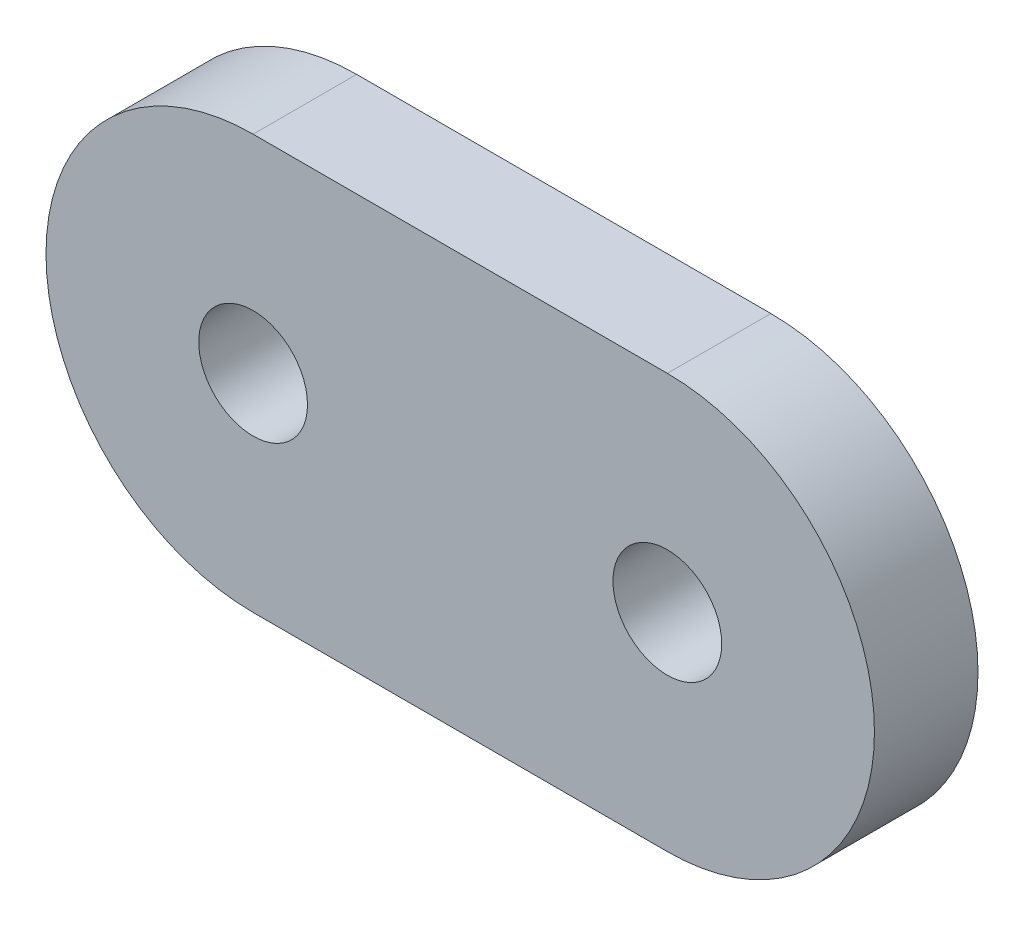
from build123d import *

# Parameters (mm, degrees)
BRIDA_BASE1_DEPTH         = 4
TALADRO_ROSCADO_M51_D     = 4.2
TALADRO_ROSCADO_M51_DEPTH = 14
TALADRO_ROSCADO_M51_TIP   = 1.2618073


# Sheet-metal steps are written as plain solids
with BuildPart() as part:
    # Croquis1 → Brida base1 (new body)
    with BuildSketch(Plane.XY):
        with BuildLine():
            Line((-19.990811444, 8), (-3.990811444, 8))
            ThreePointArc((-3.990811444, 8), (4.009188556, 0), (-3.990811444, -8))
            Line((-3.990811444, -8), (-19.990811444, -8))
            ThreePointArc((-19.990811444, -8), (-27.990811444, 0), (-19.990811444, 8))
        make_face()
    extrude(amount=-BRIDA_BASE1_DEPTH)

    # Taladro roscado M51
    with Locations(Plane.XY):
        with Locations((-19.990811444, 0), (-3.990811444, 0)):
            Hole(TALADRO_ROSCADO_M51_D / 2, depth=TALADRO_ROSCADO_M51_DEPTH)
            with Locations((0, 0, -(TALADRO_ROSCADO_M51_DEPTH + TALADRO_ROSCADO_M51_TIP / 2))):  # 118° drill point
                Cone(0, TALADRO_ROSCADO_M51_D / 2, TALADRO_ROSCADO_M51_TIP, mode=Mode.SUBTRACT)


solid = part.part
